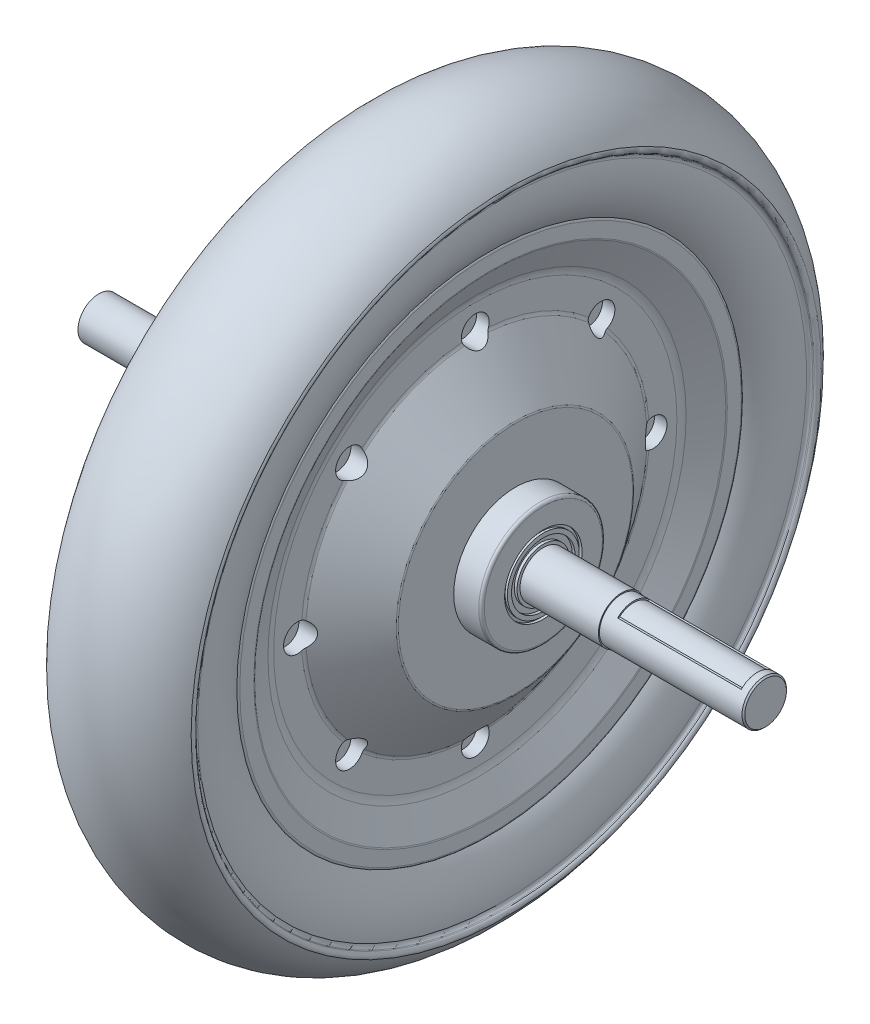
from build123d import *

# Parameters (mm, degrees)
ZAOKR_GLENIE1_R            = 1.5
ZAOKR_GLENIE2_R            = 1
ZAOKR_GLENIE3_R            = 6
ZAOKR_GLENIE4_R            = 1.5
ZAOKR_GLENIE5_R            = 2
ZAOKR_GLENIE6_R            = 2
ZAOKR_GLENIE7_R            = 2
WYTNIJ_WYCI_GNI_CIE1_START = -1.5
WYTNIJ_WYCI_GNI_CIE1_DEPTH = 1.5
SZYK_KO_OWY1_COUNT         = 6
ZAOKR_GLENIE8_R            = 2
WYTNIJ_WYCI_GNI_CIE2_START = -3
WYTNIJ_WYCI_GNI_CIE2_DEPTH = 44.5
SFAZOWANIE1_SIZE           = 0.5
WYTNIJ_WYCI_GNI_CIE3_START = 10
SZKIC4_R                   = 5.000000000000004
WYTNIJ_WYCI_GNI_CIE3_DEPTH = 44.5
SZYK_KO_OWY2_COUNT         = 8
WYTNIJ_WYCI_GNI_CIE4_START = -15
SZKIC5_R                   = 3.500000000000003
WYTNIJ_WYCI_GNI_CIE4_DEPTH = 44.5
SZYK_KO_OWY3_COUNT         = 6
SKETCH1_R                  = 7.499999999999951
BOSS_EXTRUDE1_DEPTH        = 240


with BuildPart() as part:
    # Szkic1 → Obrót1 (revolve)
    with BuildSketch(Plane.XY, mode=Mode.PRIVATE) as obr_t1_sk:
        with BuildLine():
            Line((20, 4.999999999999997), (20, 10.999999999999998))
            Line((20, 10.999999999999998), (14.5, 22.000000000000004))
            Line((14.5, 22.000000000000004), (14.499999999999998, 34))
            Line((14.499999999999998, 34), (28.999999999999996, 53.5))
            Line((28.999999999999996, 53.5), (28.999999999999996, 73.75000000000001))
            Line((28.999999999999996, 73.75000000000001), (39, 73.75000000000001))
            Line((39, 73.75000000000001), (39, 82.05000000000001))
            Line((39, 82.05000000000001), (38, 82.05))
            Line((38, 82.05), (38.17632698070847, 83.05000000000001))
            Line((38.17632698070847, 83.05000000000001), (39, 83.05))
            Line((39, 83.05), (39, 84.54999999999998))
            Line((39, 84.54999999999998), (38, 84.55))
            Line((38, 84.55), (38, 86.55))
            Line((38, 86.55), (39, 86.55))
            Line((39, 86.55), (39, 87.60000000000002))
            Line((39, 87.60000000000002), (67.2, 87.60000000000002))
            Line((67.2, 87.60000000000002), (67.2, 88.00000000000001))
            Line((67.2, 88.00000000000001), (119, 88.00000000000003))
            Line((119, 88.00000000000003), (119, 96.00000000000001))
            Line((119, 96.00000000000001), (38.99999999999997, 96.00000000000001))
            Line((38.99999999999997, 96.00000000000001), (-5.684e-14, 95.99999999999999))
            Line((-5.684e-14, 95.99999999999999), (-39.8, 95.99999999999999))
            Line((-39.8, 95.99999999999999), (-39.8, 73.99999999999999))
            Line((-39.8, 73.99999999999999), (-32.3, 73.99999999999999))
            Line((-32.3, 73.99999999999999), (-32.3, 54.499999999999986))
            Line((-32.3, 54.499999999999986), (-18.5, 27.11362229102167))
            Line((-18.5, 27.11362229102167), (-18.499999999999996, 25.113622291021667))
            Line((-18.499999999999996, 25.113622291021667), (-12.5, 25.113622291021674))
            Line((-12.5, 25.113622291021674), (-12.500000000000002, 19.113622291021677))
            Line((-12.500000000000002, 19.113622291021677), (-20.000000000000004, 13.299999999999997))
            Line((-20.000000000000004, 13.299999999999997), (-20, 4.999999999999997))
            Line((-20, 4.999999999999997), (-19.67460291848352, 4.999999999999997))
            ThreePointArc((-19.674602918483515, 4.999999999999995), (-3.55e-15, 14.899999999999999), (19.674602918483515, 4.999999999999991))
            Line((19.67460291848352, 4.999999999999997), (20, 4.999999999999997))
        make_face()
        with BuildLine():
            ThreePointArc((23.99198646267305, -14.563324044923228), (1.238e-14, 14.900000000000002), (-23.991986462673054, -14.563324044923213))
            Line((-23.991986462673054, -14.563324044923213), (-26.5, -16.085707942145415))
            ThreePointArc((-26.5, -16.085707942145415), (-4.99e-15, -31), (26.499999999999996, -16.085707942145426))
            Line((26.499999999999996, -16.085707942145426), (23.99198646267305, -14.563324044923228))
        make_face()
    revolve(obr_t1_sk.sketch.rotate(Axis((-39.8, 95.99999999999999, 0), (1, 0, 0)), 270), axis=Axis((-39.8, 95.99999999999999, 0), (1, 0, 0)))

    # Zaokrąglenie1
    zaokr_glenie1_edges = [part.edges().sort_by_distance(p)[0] for p in [
        (23.991986462673047, 96.00000000000001, -110.5633240449232),
        (26.499999999999986, 95.99999999999991, -112.0857079421454),
        (-26.5, 95.99999999999991, -112.0857079421454),
        (-23.991986462673058, 95.99999999999996, -110.56332404492319),
    ]]
    fillet(zaokr_glenie1_edges, radius=ZAOKR_GLENIE1_R)

    # Zaokrąglenie2
    # the kernel refuses this fillet: 1 mm, written as the material it adds along each edge
    with BuildSketch(Plane(origin=(-32.3, 95.99999999999999, 0), x_dir=(0, 0, 1), z_dir=(0, 1, 0))) as zaokr_glenie2_piece_1:
        with BuildLine():
            CenterArc((22 + ZAOKR_GLENIE2_R, -ZAOKR_GLENIE2_R), ZAOKR_GLENIE2_R, 90, 90)
            Line((22, -ZAOKR_GLENIE2_R), (22, 0))
            Line((22, 0), (22 + ZAOKR_GLENIE2_R, 0))
        make_face()
    revolve(axis=Axis((-32.3, 95.99999999999999, 0), (1, 0, 0)))
    # the kernel refuses this fillet: 1 mm, written as the material it takes off along each edge
    with BuildSketch(Plane(origin=(-20, 95.99999999999999, 0), x_dir=(0, 1.6e-16, 1), z_dir=(0, 1, -1.6e-16))) as zaokr_glenie2_2_piece_1:
        with BuildLine():
            CenterArc((90.26181919398189, 0.9999999999999964), ZAOKR_GLENIE2_R, 270, 47.57667786749937)
            Line((90.26181919398189, -3.55e-15), (90.99999999999999, 0))
            Line((90.99999999999999, 0), (90.99999999999999, 0.3253970815164813))
        make_face()
    revolve(axis=Axis((-20, 95.99999999999999, 0), (1, 0, 0)), mode=Mode.SUBTRACT)
    with BuildSketch(Plane(origin=(-20.000000000000004, 95.99999999999999, 0), x_dir=(0, 1.7e-16, 1), z_dir=(0, 1, -1.7e-16))) as zaokr_glenie2_2_piece_2:
        with BuildLine():
            CenterArc((82.69999999999999 + ZAOKR_GLENIE2_R * 0.490100124104, ZAOKR_GLENIE2_R), ZAOKR_GLENIE2_R, 217.78104037042274, 52.218959629577284)
            Line((82.69999999999999 - ZAOKR_GLENIE2_R * 0.30025766083, ZAOKR_GLENIE2_R * 0.387354448483), (82.69999999999999, 0))
            Line((82.69999999999999, 0), (82.69999999999999 + ZAOKR_GLENIE2_R * 0.490100124104, 0))
        make_face()
    revolve(axis=Axis((-20.000000000000004, 95.99999999999999, 0), (1, 0, 0)), mode=Mode.SUBTRACT)
    with BuildSketch(Plane(origin=(-32.3, 95.99999999999999, 0), x_dir=(0, 0, 1), z_dir=(0, 1, 0))) as zaokr_glenie2_2_piece_3:
        with BuildLine():
            CenterArc((41.5 - ZAOKR_GLENIE2_R * 0.237713014678, ZAOKR_GLENIE2_R), ZAOKR_GLENIE2_R, 270, 26.74354212463146)
            Line((41.5 - ZAOKR_GLENIE2_R * 0.237713014678, 0), (41.5, 0))
            Line((41.5, 0), (41.5 + ZAOKR_GLENIE2_R * 0.212284774783, ZAOKR_GLENIE2_R * 0.106970331131))
        make_face()
    revolve(axis=Axis((-32.3, 95.99999999999999, 0), (1, 0, 0)), mode=Mode.SUBTRACT)
    with BuildSketch(Plane(origin=(39, 95.99999999999999, 0), x_dir=(0, 0, 1), z_dir=(0, 1, 0))) as zaokr_glenie2_2_piece_4:
        with BuildLine():
            CenterArc((22.24999999999997 - ZAOKR_GLENIE2_R, -ZAOKR_GLENIE2_R), ZAOKR_GLENIE2_R, 0, 90)
            Line((22.24999999999997 - ZAOKR_GLENIE2_R, 0), (22.24999999999997, 0))
            Line((22.24999999999997, 0), (22.24999999999997, -ZAOKR_GLENIE2_R))
        make_face()
    revolve(axis=Axis((39, 95.99999999999999, 0), (1, 0, 0)), mode=Mode.SUBTRACT)
    with BuildSketch(Plane(origin=(29, 95.99999999999999, 0), x_dir=(0, 0, 1), z_dir=(0, 1, 0))) as zaokr_glenie2_2_piece_5:
        with BuildLine():
            CenterArc((42.499999999999986 - ZAOKR_GLENIE2_R * 0.331048673134, -ZAOKR_GLENIE2_R), ZAOKR_GLENIE2_R, 53.36588612403242, 36.63411387596758)
            Line((42.499999999999986 - ZAOKR_GLENIE2_R * 0.331048673134, 0), (42.499999999999986, 0))
            Line((42.499999999999986, 0), (42.499999999999986 + ZAOKR_GLENIE2_R * 0.26565409321, -ZAOKR_GLENIE2_R * 0.197537659054))
        make_face()
    revolve(axis=Axis((29, 95.99999999999999, 0), (1, 0, 0)), mode=Mode.SUBTRACT)
    with BuildSketch(Plane(origin=(20, 95.99999999999999, 0), x_dir=(0, 1.7e-16, 1), z_dir=(0, 1, -1.7e-16))) as zaokr_glenie2_2_piece_6:
        with BuildLine():
            CenterArc((84.99999999999999 + ZAOKR_GLENIE2_R * 0.2360679775, -ZAOKR_GLENIE2_R), ZAOKR_GLENIE2_R, 90, 26.565051177078175)
            Line((84.99999999999999 - ZAOKR_GLENIE2_R * 0.211145618, -ZAOKR_GLENIE2_R * 0.105572809), (84.99999999999999, 0))
            Line((84.99999999999999, 0), (84.99999999999999 + ZAOKR_GLENIE2_R * 0.2360679775, 0))
        make_face()
    revolve(axis=Axis((20, 95.99999999999999, 0), (1, 0, 0)), mode=Mode.SUBTRACT)
    with BuildSketch(Plane(origin=(20, 95.99999999999999, 0), x_dir=(0, 1.6e-16, 1), z_dir=(0, 1, -1.6e-16))) as zaokr_glenie2_2_piece_7:
        with BuildLine():
            CenterArc((90.26181919398189, -1), ZAOKR_GLENIE2_R, 42.423322132500644, 47.576677867499356)
            Line((90.26181919398189, 0), (90.99999999999999, 0))
            Line((90.99999999999999, 0), (90.99999999999999, -0.32539708151648483))
        make_face()
    revolve(axis=Axis((20, 95.99999999999999, 0), (1, 0, 0)), mode=Mode.SUBTRACT)

    # Zaokrąglenie3
    zaokr_glenie3_edges = [part.edges().sort_by_distance(p)[0] for p in [
        (-12.5, 95.99999999999996, -76.8863777089783),
        (14.5, 95.99999999999996, -73.99999999999999),
    ]]
    fillet(zaokr_glenie3_edges, radius=ZAOKR_GLENIE3_R)

    # Zaokrąglenie4
    zaokr_glenie4_edges = [part.edges().sort_by_distance(p)[0] for p in [
        (-18.499999999999996, 95.99999999999996, -70.88637770897832),
    ]]
    fillet(zaokr_glenie4_edges, radius=ZAOKR_GLENIE4_R)

    # Zaokrąglenie5
    zaokr_glenie5_edges = [part.edges().sort_by_distance(p)[0] for p in [
        (-12.5, 95.99999999999996, -70.88637770897832),
    ]]
    fillet(zaokr_glenie5_edges, radius=ZAOKR_GLENIE5_R)

    # Zaokrąglenie6
    zaokr_glenie6_edges = [part.edges().sort_by_distance(p)[0] for p in [
        (14.5, 95.99999999999997, -61.999999999999986),
    ]]
    fillet(zaokr_glenie6_edges, radius=ZAOKR_GLENIE6_R)

    # Zaokrąglenie7
    zaokr_glenie7_edges = [part.edges().sort_by_distance(p)[0] for p in [
        (-39.8, 95.99999999999997, -22),
    ]]
    fillet(zaokr_glenie7_edges, radius=ZAOKR_GLENIE7_R)

    # Wytnij-wyciągnięcie1: read off the stored shape, not the designer's step
    # Wytnij-wyciągnięcie1 outline → Wytnij-wyciągnięcie1 (cut)
    with BuildSketch(Plane.ZY.offset(32.3).offset(WYTNIJ_WYCI_GNI_CIE1_START)):
        with BuildLine():
            ThreePointArc((-9.35, 117.614347087), (0, 119.55), (9.35, 117.614347087))
            Line((9.35, 117.614347087), (21.629152068, 146))
            Line((21.629152068, 146), (-21.629152068, 146))
            Line((-21.629152068, 146), (-9.35, 117.614347087))
        make_face()
    wytnij_wyci_gni_cie1 = extrude(amount=WYTNIJ_WYCI_GNI_CIE1_DEPTH, mode=Mode.SUBTRACT)

    # Szyk kołowy1: Wytnij-wyciągnięcie1 ×6 about axis
    szyk_ko_owy1_axis = Axis((0, 95.99999999999997, -7.922e-14), (1, 0, 0))
    for i in range(1, SZYK_KO_OWY1_COUNT):
        add(wytnij_wyci_gni_cie1.rotate(szyk_ko_owy1_axis, i * 360 / SZYK_KO_OWY1_COUNT), mode=Mode.SUBTRACT)

    # Zaokrąglenie8
    # the kernel refuses this fillet: 2 mm, written as the material it adds along each edge
    with BuildSketch(Plane(origin=(-30.80000000000003, 96.00000000034805, -6.0279604e-10), x_dir=(0, -0.09014932415060015, -0.9959282601448711), z_dir=(0, -0.9959282601448711, 0.09014932415060015))) as zaokr_glenie8_piece_1:
        with BuildLine():
            CenterArc((25.486491672407734, -2.000000000000003), ZAOKR_GLENIE8_R, 90, 75.52248781407013)
            Line((25.486491672407734, -2.97e-15), (25.486491672407734, 0.03999999999999618))
            Line((25.486491672407734, 0.03999999999999618), (23.549999999304024, 0.03999999999999559))
            Line((23.549999999304024, 0.03999999999999559), (23.50999999930403, -3.56e-15))
            ThreePointArc((23.50999999930403, -3.56e-15), (23.50999999930403, -0.7500000000000036), (23.51127016584195, -1.4900000000000055))
            Line((23.51127016584195, -1.4900000000000055), (23.549999999304028, -1.5000000000000036))
        make_face()
    revolve(axis=Axis((-30.80000000000003, 96.00000000034805, -6.0279604e-10), (1, 1.7e-16, -3e-16)), revolution_arc=70.34439530994545)
    with BuildSketch(Plane(origin=(-30.80000000000003, 96.00000000069598, 0), x_dir=(0, 0.8174245115569956, -0.576035734920853), z_dir=(0, -0.576035734920853, -0.8174245115569956))) as zaokr_glenie8_piece_2:
        with BuildLine():
            CenterArc((25.486491672407716, -2.000000000000003), ZAOKR_GLENIE8_R, 90, 75.52248781407002)
            Line((25.486491672407716, -2.97e-15), (25.486491672407716, 0.03999999999999618))
            Line((25.486491672407716, 0.03999999999999618), (23.54999999930402, 0.03999999999999559))
            Line((23.54999999930402, 0.03999999999999559), (23.509999999304014, -3.56e-15))
            ThreePointArc((23.509999999304014, -3.56e-15), (23.509999999304014, -0.75), (23.51127016584195, -1.4900000000000055))
            Line((23.51127016584195, -1.4900000000000055), (23.549999999304024, -1.5000000000000036))
        make_face()
    revolve(axis=Axis((-30.80000000000003, 96.00000000069598, 0), (1, 3.5e-16, 0)), revolution_arc=70.34439530994538)
    with BuildSketch(Plane(origin=(-30.80000000000003, 96.00000000034791, 6.0271077e-10), x_dir=(0, 0.9075738357075955, 0.41989252522401777), z_dir=(0, 0.41989252522401777, -0.9075738357075955))) as zaokr_glenie8_piece_3:
        with BuildLine():
            CenterArc((25.486491672407737, -2.000000000000003), ZAOKR_GLENIE8_R, 90, 75.52248781407013)
            Line((25.486491672407737, -2.97e-15), (25.486491672407737, 0.03999999999999618))
            Line((25.486491672407737, 0.03999999999999618), (23.54999999930402, 0.03999999999999559))
            Line((23.54999999930402, 0.03999999999999559), (23.509999999304018, -3.56e-15))
            ThreePointArc((23.509999999304018, -3.56e-15), (23.509999999304018, -0.7500000000000037), (23.511270165841943, -1.4900000000000055))
            Line((23.511270165841943, -1.4900000000000055), (23.549999999304028, -1.5000000000000036))
        make_face()
    revolve(axis=Axis((-30.80000000000003, 96.00000000034791, 6.0271077e-10), (1, 1.7e-16, 3e-16)), revolution_arc=70.34439530994545)
    with BuildSketch(Plane(origin=(-30.80000000000003, 95.99999999965189, 6.0262551e-10), x_dir=(0, 0.0901493241506014, 0.995928260144871), z_dir=(0, 0.995928260144871, -0.0901493241506014))) as zaokr_glenie8_piece_4:
        with BuildLine():
            CenterArc((25.486491672407734, -2.000000000000003), ZAOKR_GLENIE8_R, 90, 75.52248781407013)
            Line((25.486491672407734, -2.97e-15), (25.486491672407734, 0.03999999999999618))
            Line((25.486491672407734, 0.03999999999999618), (23.54999999930402, 0.03999999999999559))
            Line((23.54999999930402, 0.03999999999999559), (23.50999999930403, -3.56e-15))
            ThreePointArc((23.50999999930403, -3.56e-15), (23.509999999304025, -0.75), (23.511270165841953, -1.4900000000000055))
            Line((23.511270165841953, -1.4900000000000055), (23.549999999304028, -1.5000000000000036))
        make_face()
    revolve(axis=Axis((-30.80000000000003, 95.99999999965189, 6.0262551e-10), (1, -1.7e-16, 3e-16)), revolution_arc=70.34439530994551)
    with BuildSketch(Plane(origin=(-30.80000000000003, 95.99999999930397, -1.5845e-13), x_dir=(0, -0.8174245115569956, 0.576035734920853), z_dir=(0, 0.576035734920853, 0.8174245115569956))) as zaokr_glenie8_piece_5:
        with BuildLine():
            CenterArc((25.48649167240772, -2.000000000000003), ZAOKR_GLENIE8_R, 90, 75.52248781407002)
            Line((25.48649167240772, -2.97e-15), (25.48649167240772, 0.03999999999999618))
            Line((25.48649167240772, 0.03999999999999618), (23.549999999304024, 0.03999999999999559))
            Line((23.549999999304024, 0.03999999999999559), (23.509999999304014, -3.56e-15))
            ThreePointArc((23.509999999304014, -3.56e-15), (23.509999999304014, -0.7500000000000036), (23.51127016584195, -1.4900000000000055))
            Line((23.51127016584195, -1.4900000000000055), (23.549999999304024, -1.5000000000000036))
        make_face()
    revolve(axis=Axis((-30.80000000000003, 95.99999999930397, -1.5845e-13), (1, -3.5e-16, 0)), revolution_arc=70.34439530994538)
    with BuildSketch(Plane(origin=(-30.80000000000003, 95.99999999965203, -6.0289551e-10), x_dir=(0, -0.9075738357075963, -0.4198925252240163), z_dir=(0, -0.4198925252240163, 0.9075738357075963))) as zaokr_glenie8_piece_6:
        with BuildLine():
            CenterArc((25.486491672407737, -2.0000000000000036), ZAOKR_GLENIE8_R, 90, 75.52248781407013)
            Line((25.486491672407737, -2.97e-15), (25.486491672407737, 0.03999999999999619))
            Line((25.486491672407737, 0.03999999999999619), (23.549999999304017, 0.0399999999999956))
            Line((23.549999999304017, 0.0399999999999956), (23.50999999930403, -3.56e-15))
            ThreePointArc((23.50999999930403, -3.56e-15), (23.50999999930403, -0.7500000000000003), (23.511270165841957, -1.4900000000000058))
            Line((23.511270165841957, -1.4900000000000058), (23.54999999930403, -1.500000000000004))
        make_face()
    revolve(axis=Axis((-30.80000000000003, 95.99999999965203, -6.0289551e-10), (1, -1.7e-16, -3e-16)), revolution_arc=70.3443953099455)

    # Szkic3 → Wytnij-wyciągnięcie2 (cut)
    with BuildSketch(Plane(origin=(119, 0, 0), x_dir=(0, 0, -1), z_dir=(1, 3.5e-16, 0)).offset(WYTNIJ_WYCI_GNI_CIE2_START)):
        Polygon((-15.000000000000002, 101.57000000000002), (15.000000000000002, 101.57000000000002), (15.000000000000002, 114.57000000000004), (-15.000000000000004, 114.57000000000004), align=None)
    extrude(amount=-WYTNIJ_WYCI_GNI_CIE2_DEPTH, mode=Mode.SUBTRACT)

    # Sfazowanie1
    sfazowanie1_edges = [part.edges().sort_by_distance(p)[0] for p in [
        (119.00000000000001, 95.99999999999999, -7.999999999999957),
    ]]
    chamfer(sfazowanie1_edges, length=SFAZOWANIE1_SIZE)

    # Szkic4 → Wytnij-wyciągnięcie3 (cut)
    with BuildSketch(Plane(origin=(0, 0, 0), x_dir=(0, 0, -1), z_dir=(1, 0, 0)).offset(WYTNIJ_WYCI_GNI_CIE3_START)):
        with Locations(Location((0, 159.99999999999997, 0), (0, 0, 197.68876089))):
            Circle(SZKIC4_R)
    wytnij_wyci_gni_cie3 = extrude(amount=WYTNIJ_WYCI_GNI_CIE3_DEPTH, mode=Mode.SUBTRACT)

    # Szyk kołowy2: Wytnij-wyciągnięcie3 ×8 about axis
    szyk_ko_owy2_axis = Axis((0, 95.99999999999999, 5.464e-14), (1, 0, 0))
    for i in range(1, SZYK_KO_OWY2_COUNT):
        add(wytnij_wyci_gni_cie3.rotate(szyk_ko_owy2_axis, i * 360 / SZYK_KO_OWY2_COUNT), mode=Mode.SUBTRACT)

    # Szkic5 → Wytnij-wyciągnięcie4 (cut)
    with BuildSketch(Plane(origin=(0, 0, 0), x_dir=(0, 0, -1), z_dir=(1, 0, 0)).offset(WYTNIJ_WYCI_GNI_CIE4_START)):
        with Locations((0, 159.99999999999997)):
            Circle(SZKIC5_R)
    wytnij_wyci_gni_cie4 = extrude(amount=-WYTNIJ_WYCI_GNI_CIE4_DEPTH, mode=Mode.SUBTRACT)

    # Szyk kołowy3: Wytnij-wyciągnięcie4 ×6 about axis
    szyk_ko_owy3_axis = Axis((0, 96, -7.922e-14), (1, 0, 0))
    for i in range(1, SZYK_KO_OWY3_COUNT):
        add(wytnij_wyci_gni_cie4.rotate(szyk_ko_owy3_axis, i * 360 / SZYK_KO_OWY3_COUNT), mode=Mode.SUBTRACT)

    # Sketch1 → Boss-Extrude1 (add)
    with BuildSketch(Plane(origin=(119, 0, 0), x_dir=(0, 0, -1), z_dir=(1, 0, 0))):
        with Locations((0, 95.99999999999999)):
            Circle(SKETCH1_R)
    extrude(amount=-BOSS_EXTRUDE1_DEPTH)


solid = part.part
